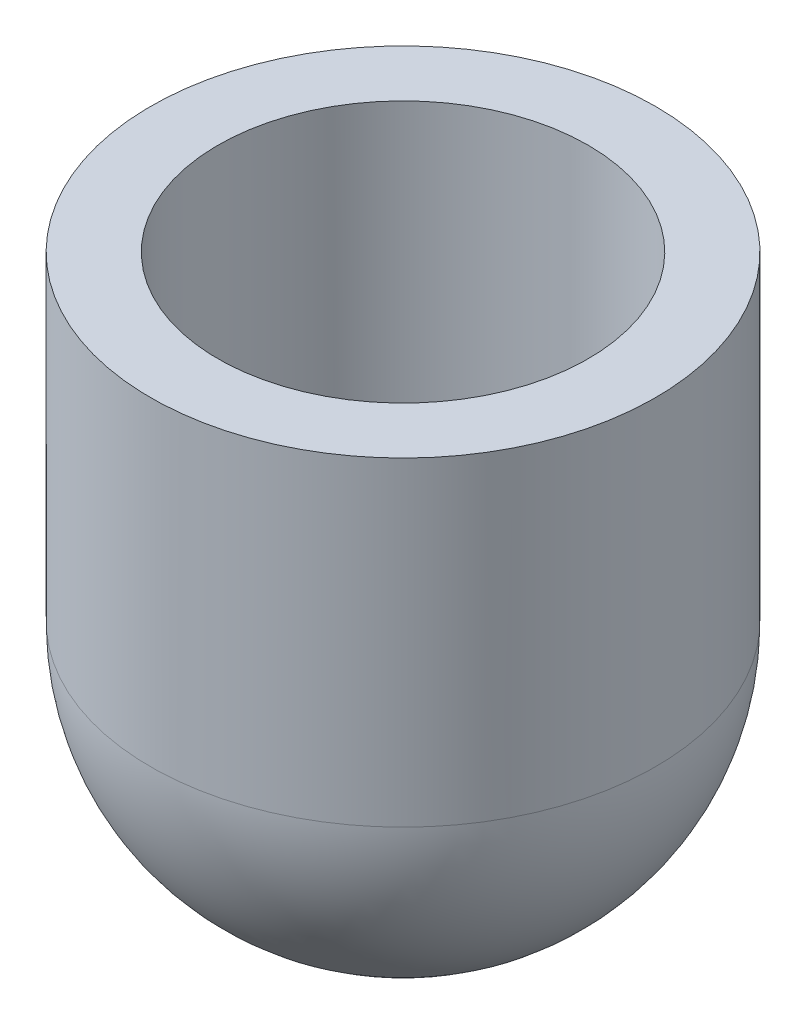
from build123d import *


with BuildPart() as part:
    # Sketch1 → Revolve1 (revolve)
    with BuildSketch(Plane.XY):
        with BuildLine():
            Line((-7.5, 0), (-7.5, -9.5))
            ThreePointArc((-7.5, -9.5), (-5.303300859, -14.803300859), (0, -17))
            Line((0, -17), (0, -15))
            ThreePointArc((0, -15), (-3.889087297, -13.389087297), (-5.5, -9.5))
            Line((-5.5, -9.5), (-5.5, 0))
            Line((-5.5, 0), (-7.5, 0))
        make_face()
    revolve(axis=Axis((0, -17, 0), (0, 1, 0)))


solid = part.part
